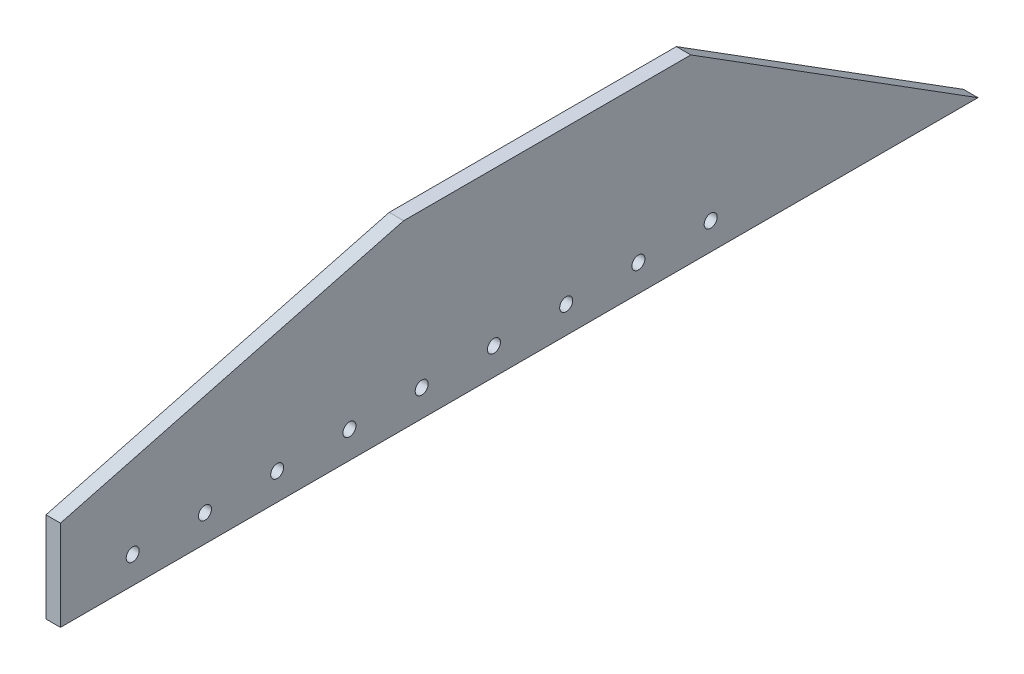
from build123d import *

# Parameters (mm, degrees)
SKETCH2_R           = 1.8
BOSS_EXTRUDE1_DEPTH = 4


with BuildPart() as part:
    # Sketch2 → Boss-Extrude1 (new body)
    with BuildSketch(Plane(origin=(0, 0, 0), x_dir=(0, 0, -1), z_dir=(1, 0, 0))):
        Polygon((10.740740741, 50.216049383), (90.240740741, 50.216049383), (169.740740741, 0.216049383), (-84.259259259, 0.216049383), (-84.259259259, 25.216049383), align=None)
        with Locations((-64.259259259, 7.716049383)):
            Circle(SKETCH2_R, mode=Mode.SUBTRACT)
        with Locations((-44.259259259, 7.716049383)):
            Circle(SKETCH2_R, mode=Mode.SUBTRACT)
        with Locations((-24.259259259, 7.716049383)):
            Circle(SKETCH2_R, mode=Mode.SUBTRACT)
        with Locations((-4.259259259, 7.716049383)):
            Circle(SKETCH2_R, mode=Mode.SUBTRACT)
        with Locations((15.740740741, 7.716049383)):
            Circle(SKETCH2_R, mode=Mode.SUBTRACT)
        with Locations((35.740740741, 7.716049383)):
            Circle(SKETCH2_R, mode=Mode.SUBTRACT)
        with Locations((55.740740741, 7.716049383)):
            Circle(SKETCH2_R, mode=Mode.SUBTRACT)
        with Locations((75.740740741, 7.716049383)):
            Circle(SKETCH2_R, mode=Mode.SUBTRACT)
        with Locations((95.740740741, 7.716049383)):
            Circle(SKETCH2_R, mode=Mode.SUBTRACT)
    extrude(amount=BOSS_EXTRUDE1_DEPTH)


solid = part.part
